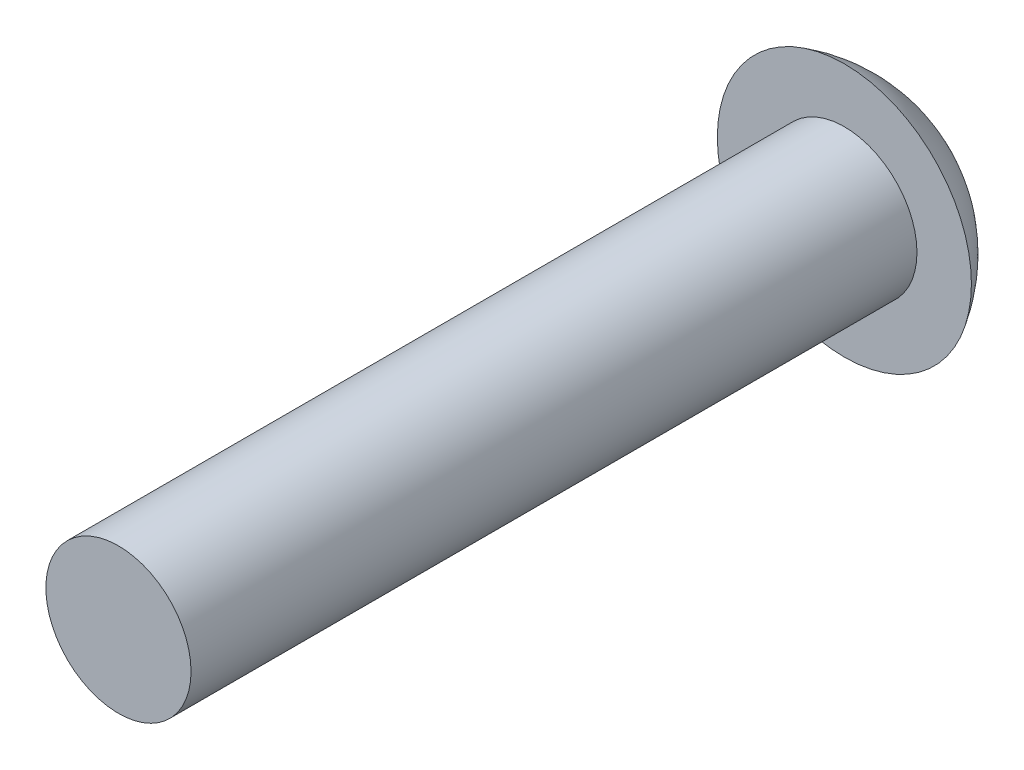
from build123d import *

# Parameters (mm, degrees)
CROQUIS2_R                   = 2
SALIENTE_EXTRUIR1_DEPTH      = 20
CORTAR_EXTRUIR_L_MINA2_START = -0.6
CORTAR_EXTRUIR_L_MINA2_DEPTH = 0.6


# Read off the part's stored shape, not the designer's step: Cortar-Extruir-Lámina2
with BuildPart() as part:
    # Croquis2 → Saliente-Extruir1 (new body)
    with BuildSketch(Plane.XY):
        Circle(CROQUIS2_R)
    extrude(amount=-SALIENTE_EXTRUIR1_DEPTH)

    # Croquis4 → Revolución1 (revolve)
    with BuildSketch(Plane(origin=(0, 0, 0), x_dir=(1, 0, 0), z_dir=(0, 1, 0))):
        with BuildLine():
            Line((3.5, 20), (0, 20))
            Line((0, 20), (0, 22))
            ThreePointArc((0, 22), (2.015564437, 21.464737765), (3.5, 20))
        make_face()
    revolve(axis=Axis((0, 0, -20), (0, 0, -1)))

    # Cortar-Extruir-Lámina2 outline → Cortar-Extruir-Lámina2 (cut)
    with BuildSketch(Plane(origin=(0, 0, -22), x_dir=(-1, 0, 0), z_dir=(0, 0, -1)).offset(CORTAR_EXTRUIR_L_MINA2_START)):
        Polygon((0.1, -2), (0.1, -0.1), (2, -0.1), (2, 0.1), (0.1, 0.1), (0.1, 2), (-0.1, 2), (-0.1, 0.1), (-2, 0.1), (-2, -0.1), (-0.1, -0.1), (-0.1, -2), align=None)
    extrude(amount=CORTAR_EXTRUIR_L_MINA2_DEPTH, mode=Mode.SUBTRACT)


solid = part.part
